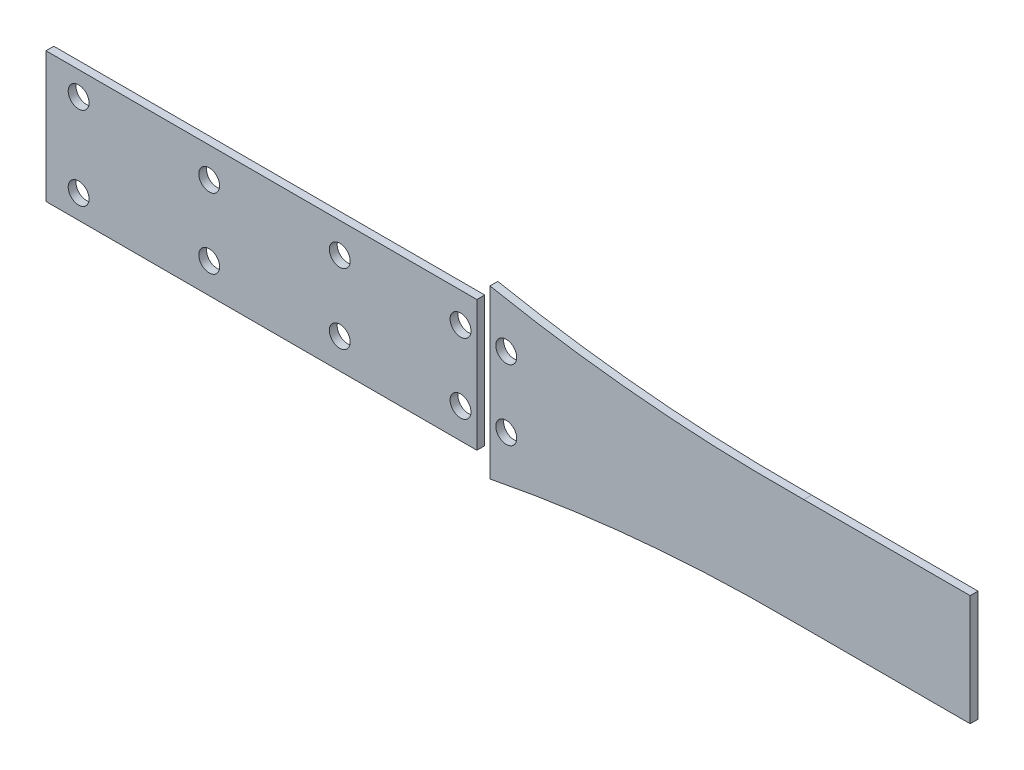
from build123d import *

# Parameters (mm, degrees)
BOSS_EXTRUDE1_DEPTH      = 0.6
BOSS_EXTRUDE1_DEPTH_BACK = 0.6
BOSS_EXTRUDE2_DEPTH      = 0.6
BOSS_EXTRUDE2_DEPTH_BACK = 0.6
SKETCH3_W                = 65.999999997
SKETCH3_H                = 20
SKETCH3_R                = 1.6
CUT_EXTRUDE1_DEPTH       = 211.503888964
CUT_EXTRUDE1_DEPTH_BACK  = 211.503888964
SKETCH4_R                = 1.6


with BuildPart() as part:
    # Sketch2 → Boss-Extrude1 (new, two sides: drawn at the far end of the back side and taken through both)
    with BuildSketch(Plane.XY.offset(-BOSS_EXTRUDE1_DEPTH_BACK)):
        with BuildLine():
            Line((209.661357245, 14.5), (184.174027055, 14.5))
            add(Edge.make_bspline(
                [(184.174027055, 14.5), (183.824253427, 14.5), (182.94620639, 14.5), (181.667799963, 14.5), (180.804171148, 14.5), (176.695940371, 14.5), (170.015725266, 14.670138318), (160.683426305, 15.282569394), (151.378685363, 16.272936281), (144.757083805, 17.247503899), (139.459652196, 18.166033814), (137.792001296, 18.473604313), (136.101357243, 18.805384896)],
                knots=[0.04382985, 0.04382985, 0.04382985, 0.04382985, 0.045875996, 0.04917636, 0.052476723, 0.052476723, 0.08232242, 0.112168116, 0.142013813, 0.17185951, 0.17185951, 0.185262545, 0.185262545, 0.185262545, 0.185262545], degree=3))
            Line((136.101357245, 18.805384896), (136.101357245, -6.805384896))
            add(Edge.make_bspline(
                [(184.174027055, -2.5), (183.824253427, -2.5), (182.946206391, -2.5), (181.667799963, -2.5), (180.804171148, -2.5), (176.695940371, -2.5), (170.015725267, -2.670138318), (160.683426305, -3.282569394), (151.378685364, -4.272936281), (144.757083805, -5.247503899), (139.459652196, -6.166033814), (137.792001296, -6.473604313), (136.101357243, -6.805384896)],
                knots=[0.04382985, 0.04382985, 0.04382985, 0.04382985, 0.045875996, 0.04917636, 0.052476723, 0.052476723, 0.08232242, 0.112168116, 0.142013813, 0.17185951, 0.17185951, 0.185262545, 0.185262545, 0.185262545, 0.185262545], degree=3))
            Line((184.174027055, -2.5), (209.661357245, -2.5))
            Line((209.661357245, -2.5), (209.661357245, 14.5))
        make_face()
    extrude(amount=BOSS_EXTRUDE1_DEPTH + BOSS_EXTRUDE1_DEPTH_BACK)

    # Sketch4 → Cut-Extrude1 (cut, two sides: drawn at the far end of the back side and taken through both)
    with BuildSketch(Plane.XY.offset(-CUT_EXTRUDE1_DEPTH_BACK)):
        with Locations((138.601357245, 11.371281292)):
            Circle(SKETCH4_R)
        with Locations((138.601357245, 0.628718708)):
            Circle(SKETCH4_R)
    extrude(amount=CUT_EXTRUDE1_DEPTH + CUT_EXTRUDE1_DEPTH_BACK, mode=Mode.SUBTRACT)


with BuildPart() as body_2:
    # Sketch3 → Boss-Extrude2 (new, two sides: drawn at the far end of the back side and taken through both)
    with BuildSketch(Plane.XY.offset(-BOSS_EXTRUDE2_DEPTH_BACK)):
        with Locations((101.101357244, 6)):
            Rectangle(SKETCH3_W, SKETCH3_H)
        with Locations((73.101357245, 12.371281292)):
            Circle(SKETCH3_R, mode=Mode.SUBTRACT)
        with Locations((73.101357245, -0.371281292)):
            Circle(SKETCH3_R, mode=Mode.SUBTRACT)
        with Locations((93.101357245, 0.628718708)):
            Circle(SKETCH3_R, mode=Mode.SUBTRACT)
        with Locations((93.101357245, 11.371281292)):
            Circle(SKETCH3_R, mode=Mode.SUBTRACT)
        with Locations((131.601357245, 0.628718708)):
            Circle(SKETCH3_R, mode=Mode.SUBTRACT)
        with Locations((131.601357245, 11.371281292)):
            Circle(SKETCH3_R, mode=Mode.SUBTRACT)
        with Locations((113.101357245, 0.628718708)):
            Circle(SKETCH3_R, mode=Mode.SUBTRACT)
        with Locations((113.101357245, 11.371281292)):
            Circle(SKETCH3_R, mode=Mode.SUBTRACT)
    extrude(amount=BOSS_EXTRUDE2_DEPTH + BOSS_EXTRUDE2_DEPTH_BACK)


solid = Compound([part.part, body_2.part])
